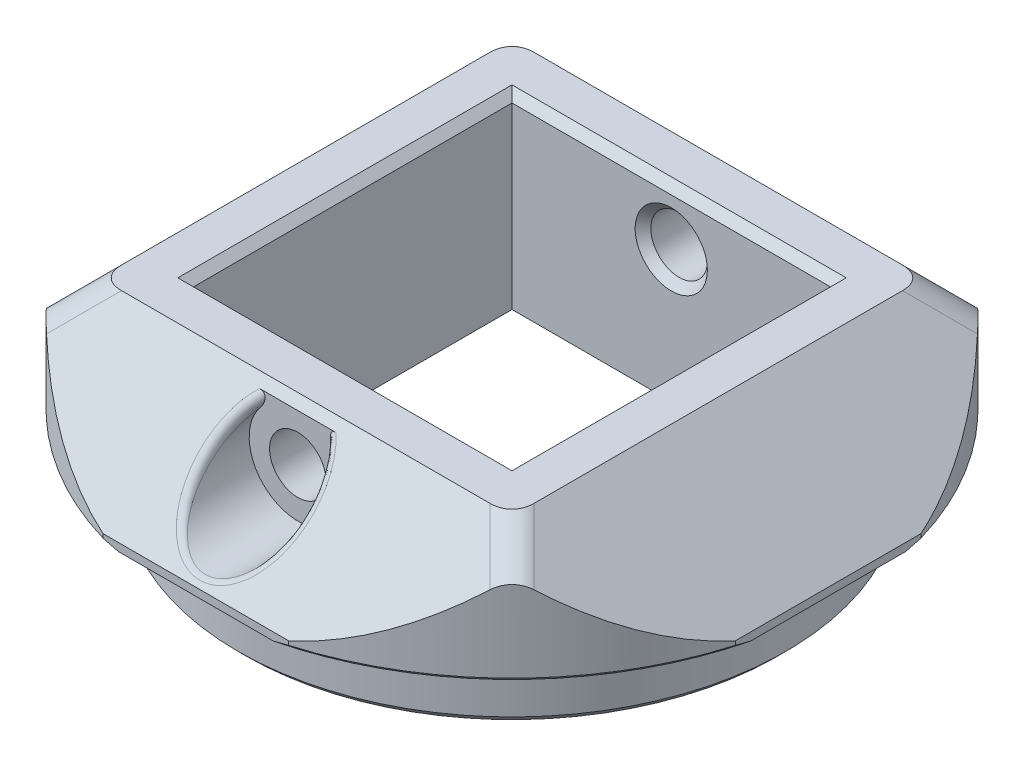
from build123d import *

# Parameters (mm, degrees)
SKETCH1_R           = 17.45
SKETCH1_W           = 20.3
SKETCH1_H           = 20.3
BOSS_EXTRUDE1_DEPTH = 4.9
SKETCH7_R           = 21
SKETCH7_W           = 20.3
SKETCH7_H           = 20.3
BOSS_EXTRUDE5_DEPTH = 0.5
SKETCH6_W           = 26.3
SKETCH6_H           = 26.3
SKETCH6_W_2         = 20.3
SKETCH6_H_2         = 20.3
BOSS_EXTRUDE4_DEPTH = 7
CHAMFER1_SIZE       = 7
CUT_EXTRUDE5_DEPTH  = 40.561123594
CUT_EXTRUDE6_START  = -3.5
SKETCH8_3_R         = 3.1
SKETCH8_3_R_2       = 1.8
CUT_EXTRUDE6_DEPTH  = 37.061123594
SKETCH9_W           = 56.090953644
SKETCH9_H           = 56.400634548
CUT_EXTRUDE7_DEPTH  = 31.512292605
SKETCH10_R          = 2.2
CUT_EXTRUDE8_DEPTH  = 7
CHAMFER2_SIZE       = 0.5
CHAMFER3_SIZE       = 0.25
FILLET1_R           = 0.5
FILLET2_R           = 2


with BuildPart() as part:
    # Sketch1 → Boss-Extrude1 (new body)
    with BuildSketch(Plane(origin=(0, 0, 0), x_dir=(1, 0, 0), z_dir=(0, 1, 0))):
        with Locations(Location((0, 0, 0), (0, 0, 270))):
            Circle(SKETCH1_R)
        Rectangle(SKETCH1_W, SKETCH1_H, mode=Mode.SUBTRACT)
    extrude(amount=BOSS_EXTRUDE1_DEPTH)

    # Sketch7 → Boss-Extrude5 (add)
    with BuildSketch(Plane(origin=(0, 4.9, 0), x_dir=(1, 0, 0), z_dir=(0, 1, 0))):
        with Locations(Location((0, 0, 0), (0, 0, 270))):
            Circle(SKETCH7_R)
        Rectangle(SKETCH7_W, SKETCH7_H, mode=Mode.SUBTRACT)
    extrude(amount=BOSS_EXTRUDE5_DEPTH)

    # Sketch6 → Boss-Extrude4 (add)
    with BuildSketch(Plane(origin=(0, 5.4, 0), x_dir=(1, 0, 0), z_dir=(0, 1, 0))):
        Rectangle(SKETCH6_W, SKETCH6_H)
        Rectangle(SKETCH6_W_2, SKETCH6_H_2, mode=Mode.SUBTRACT)
    extrude(amount=BOSS_EXTRUDE4_DEPTH)

    # Chamfer1
    # the kernel refuses this chamfer: 7 mm, written as the material it adds along each edge
    with BuildSketch(Plane(origin=(-13.15, 5.4, -13.15), x_dir=(-0.9996219169112968, -0.027495876610586358, 0), z_dir=(0, 0, 1))) as chamfer1_piece_1_section:
        Polygon((CHAMFER1_SIZE * 0.999621916911, -CHAMFER1_SIZE * 0.0274958766106), (-CHAMFER1_SIZE * 0.0274958766106, -CHAMFER1_SIZE * 0.999621916911), (0, 0), align=None)
    chamfer1_piece_1 = extrude(amount=26.3, mode=Mode.PRIVATE)
    chamfer1_piece_1 = chamfer1_piece_1 & Plane(origin=(0, 7.778644628, 0), x_dir=(0, 0, 1), z_dir=(0, -1, 0)) * Cylinder(21, 81, mode=Mode.PRIVATE)
    chamfer1_piece_1 = split(chamfer1_piece_1, bisect_by=Plane(origin=(-15.312931496, 12.4, -1e-09), z_dir=(0, -1, 0)), keep=Keep.TOP, mode=Mode.PRIVATE)
    add(chamfer1_piece_1)
    with BuildSketch(Plane(origin=(13.15, 5.4, -13.15), x_dir=(0, -0.027495876610586358, -0.9996219169112968), z_dir=(-1, 0, 0))) as chamfer1_piece_2_section:
        Polygon((CHAMFER1_SIZE * 0.999621916911, -CHAMFER1_SIZE * 0.0274958766106), (-CHAMFER1_SIZE * 0.0274958766106, -CHAMFER1_SIZE * 0.999621916911), (0, 0), align=None)
    chamfer1_piece_2 = extrude(amount=26.3, mode=Mode.PRIVATE)
    chamfer1_piece_2 = chamfer1_piece_2 & Plane(origin=(0, 7.778644628, 0), x_dir=(0, 0, 1), z_dir=(0, -1, 0)) * Cylinder(21, 81, mode=Mode.PRIVATE)
    chamfer1_piece_2 = split(chamfer1_piece_2, bisect_by=Plane(origin=(1e-09, 12.4, -15.312931496), z_dir=(0, -1, 0)), keep=Keep.TOP, mode=Mode.PRIVATE)
    add(chamfer1_piece_2)
    with BuildSketch(Plane(origin=(13.15, 5.4, 13.15), x_dir=(0.9996219169112968, -0.027495876610586358, 0), z_dir=(0, 0, -1))) as chamfer1_piece_3_section:
        Polygon((CHAMFER1_SIZE * 0.999621916911, -CHAMFER1_SIZE * 0.0274958766106), (-CHAMFER1_SIZE * 0.0274958766106, -CHAMFER1_SIZE * 0.999621916911), (0, 0), align=None)
    chamfer1_piece_3 = extrude(amount=26.3, mode=Mode.PRIVATE)
    chamfer1_piece_3 = chamfer1_piece_3 & Plane(origin=(0, 7.778644628, 0), x_dir=(0, 0, 1), z_dir=(0, -1, 0)) * Cylinder(21, 81, mode=Mode.PRIVATE)
    chamfer1_piece_3 = split(chamfer1_piece_3, bisect_by=Plane(origin=(15.312931496, 12.4, 1e-09), z_dir=(0, -1, 0)), keep=Keep.TOP, mode=Mode.PRIVATE)
    add(chamfer1_piece_3)
    with BuildSketch(Plane(origin=(-13.15, 5.4, 13.15), x_dir=(0, -0.027495876610586358, 0.9996219169112968), z_dir=(1, 0, 0))) as chamfer1_piece_4_section:
        Polygon((CHAMFER1_SIZE * 0.999621916911, -CHAMFER1_SIZE * 0.0274958766106), (-CHAMFER1_SIZE * 0.0274958766106, -CHAMFER1_SIZE * 0.999621916911), (0, 0), align=None)
    chamfer1_piece_4 = extrude(amount=26.3, mode=Mode.PRIVATE)
    chamfer1_piece_4 = chamfer1_piece_4 & Plane(origin=(0, 7.778644628, 0), x_dir=(0, 0, 1), z_dir=(0, -1, 0)) * Cylinder(21, 81, mode=Mode.PRIVATE)
    chamfer1_piece_4 = split(chamfer1_piece_4, bisect_by=Plane(origin=(5e-09, 12.4, 15.312931502), z_dir=(0, -1, 0)), keep=Keep.TOP, mode=Mode.PRIVATE)
    add(chamfer1_piece_4)
    with BuildSketch(Plane(origin=(13.15, 5.4, -13.15), x_dir=(0, -0.027495876610586358, -0.9996219169112968), z_dir=(-1, 0, 0))) as chamfer1_piece_5a_section:
        Polygon((CHAMFER1_SIZE * 0.999621916911, -CHAMFER1_SIZE * 0.0274958766106), (-CHAMFER1_SIZE * 0.0274958766106, -CHAMFER1_SIZE * 0.999621916911), (0, 0), align=None)
    chamfer1_piece_5a = extrude(amount=44.301780916, mode=Mode.PRIVATE)
    chamfer1_piece_5a = chamfer1_piece_5a & Plane(origin=(0, 8.454798528, 0), x_dir=(0, 0, 1), z_dir=(0, -1, 0)) * Cylinder(21, 117, mode=Mode.PRIVATE)
    chamfer1_piece_5a = split(chamfer1_piece_5a, bisect_by=Plane(origin=(-13.15, 8.454798528, -14.047221262), z_dir=(-1, 0, 0)), keep=Keep.TOP, mode=Mode.PRIVATE)
    chamfer1_piece_5a = split(chamfer1_piece_5a, bisect_by=Plane(origin=(-14.361884476, 12.4, -14.047221262), z_dir=(0, -1, 0)), keep=Keep.TOP, mode=Mode.PRIVATE)
    with BuildSketch(Plane(origin=(-13.15, 5.4, -31.151780916), x_dir=(-0.9996219169112968, -0.027495876610586358, 0), z_dir=(0, 0, 1))) as chamfer1_piece_5b_section:
        Polygon((CHAMFER1_SIZE * 0.999621916911, -CHAMFER1_SIZE * 0.0274958766106), (-CHAMFER1_SIZE * 0.0274958766106, -CHAMFER1_SIZE * 0.999621916911), (0, 0), align=None)
    chamfer1_piece_5b = extrude(amount=44.301780916, mode=Mode.PRIVATE)
    chamfer1_piece_5b = chamfer1_piece_5b & Plane(origin=(0, 8.454798526, 0), x_dir=(0, 0, 1), z_dir=(0, -1, 0)) * Cylinder(21, 117, mode=Mode.PRIVATE)
    chamfer1_piece_5b = split(chamfer1_piece_5b, bisect_by=Plane(origin=(-14.047221262, 8.454798526, -13.15), z_dir=(0, 0, -1)), keep=Keep.TOP, mode=Mode.PRIVATE)
    chamfer1_piece_5b = split(chamfer1_piece_5b, bisect_by=Plane(origin=(-14.047221262, 12.4, -14.361884476), z_dir=(0, -1, 0)), keep=Keep.TOP, mode=Mode.PRIVATE)
    chamfer1_piece_5 = chamfer1_piece_5a & chamfer1_piece_5b
    add(chamfer1_piece_5)
    with BuildSketch(Plane(origin=(-31.151780916, 5.4, 13.15), x_dir=(0, -0.027495876610586358, 0.9996219169112968), z_dir=(1, 0, 0))) as chamfer1_piece_6a_section:
        Polygon((CHAMFER1_SIZE * 0.999621916911, -CHAMFER1_SIZE * 0.0274958766106), (-CHAMFER1_SIZE * 0.0274958766106, -CHAMFER1_SIZE * 0.999621916911), (0, 0), align=None)
    chamfer1_piece_6a = extrude(amount=44.301780916, mode=Mode.PRIVATE)
    chamfer1_piece_6a = chamfer1_piece_6a & Plane(origin=(0, 8.454798528, 0), x_dir=(0, 0, 1), z_dir=(0, -1, 0)) * Cylinder(21, 117, mode=Mode.PRIVATE)
    chamfer1_piece_6a = split(chamfer1_piece_6a, bisect_by=Plane(origin=(-13.15, 8.454798528, 14.047221262), z_dir=(-1, 0, 0)), keep=Keep.TOP, mode=Mode.PRIVATE)
    chamfer1_piece_6a = split(chamfer1_piece_6a, bisect_by=Plane(origin=(-14.361884478, 12.4, 14.047221262), z_dir=(0, -1, 0)), keep=Keep.TOP, mode=Mode.PRIVATE)
    with BuildSketch(Plane(origin=(-13.15, 5.4, -13.15), x_dir=(-0.9996219169112968, -0.027495876610586358, 0), z_dir=(0, 0, 1))) as chamfer1_piece_6b_section:
        Polygon((CHAMFER1_SIZE * 0.999621916911, -CHAMFER1_SIZE * 0.0274958766106), (-CHAMFER1_SIZE * 0.0274958766106, -CHAMFER1_SIZE * 0.999621916911), (0, 0), align=None)
    chamfer1_piece_6b = extrude(amount=44.301780916, mode=Mode.PRIVATE)
    chamfer1_piece_6b = chamfer1_piece_6b & Plane(origin=(0, 8.454798528, 0), x_dir=(0, 0, 1), z_dir=(0, -1, 0)) * Cylinder(21, 117, mode=Mode.PRIVATE)
    chamfer1_piece_6b = split(chamfer1_piece_6b, bisect_by=Plane(origin=(-14.047221262, 8.454798528, 13.15), z_dir=(0, 0, 1)), keep=Keep.TOP, mode=Mode.PRIVATE)
    chamfer1_piece_6b = split(chamfer1_piece_6b, bisect_by=Plane(origin=(-14.047221262, 12.4, 14.361884476), z_dir=(0, -1, 0)), keep=Keep.TOP, mode=Mode.PRIVATE)
    chamfer1_piece_6 = chamfer1_piece_6a & chamfer1_piece_6b
    add(chamfer1_piece_6)
    with BuildSketch(Plane(origin=(13.15, 5.4, 13.15), x_dir=(0.9996219169112968, -0.027495876610586358, 0), z_dir=(0, 0, -1))) as chamfer1_piece_7a_section:
        Polygon((CHAMFER1_SIZE * 0.999621916911, -CHAMFER1_SIZE * 0.0274958766106), (-CHAMFER1_SIZE * 0.0274958766106, -CHAMFER1_SIZE * 0.999621916911), (0, 0), align=None)
    chamfer1_piece_7a = extrude(amount=44.301780916, mode=Mode.PRIVATE)
    chamfer1_piece_7a = chamfer1_piece_7a & Plane(origin=(0, 8.454798529, 0), x_dir=(0, 0, 1), z_dir=(0, -1, 0)) * Cylinder(21, 117, mode=Mode.PRIVATE)
    chamfer1_piece_7a = split(chamfer1_piece_7a, bisect_by=Plane(origin=(14.047221263, 12.4, -14.361884476), z_dir=(0, -1, 0)), keep=Keep.TOP, mode=Mode.PRIVATE)
    chamfer1_piece_7a = split(chamfer1_piece_7a, bisect_by=Plane(origin=(14.047221263, 8.454798529, -13.15), z_dir=(0, 0, -1)), keep=Keep.TOP, mode=Mode.PRIVATE)
    with BuildSketch(Plane(origin=(31.151780916, 5.4, -13.15), x_dir=(0, -0.027495876610586358, -0.9996219169112968), z_dir=(-1, 0, 0))) as chamfer1_piece_7b_section:
        Polygon((CHAMFER1_SIZE * 0.999621916911, -CHAMFER1_SIZE * 0.0274958766106), (-CHAMFER1_SIZE * 0.0274958766106, -CHAMFER1_SIZE * 0.999621916911), (0, 0), align=None)
    chamfer1_piece_7b = extrude(amount=44.301780916, mode=Mode.PRIVATE)
    chamfer1_piece_7b = chamfer1_piece_7b & Plane(origin=(0, 8.454798526, 0), x_dir=(0, 0, 1), z_dir=(0, -1, 0)) * Cylinder(21, 117, mode=Mode.PRIVATE)
    chamfer1_piece_7b = split(chamfer1_piece_7b, bisect_by=Plane(origin=(14.361884476, 12.4, -14.047221262), z_dir=(0, -1, 0)), keep=Keep.TOP, mode=Mode.PRIVATE)
    chamfer1_piece_7b = split(chamfer1_piece_7b, bisect_by=Plane(origin=(13.15, 8.454798526, -14.047221262), z_dir=(1, 0, 0)), keep=Keep.TOP, mode=Mode.PRIVATE)
    chamfer1_piece_7 = chamfer1_piece_7a & chamfer1_piece_7b
    add(chamfer1_piece_7)
    with BuildSketch(Plane(origin=(-13.15, 5.4, 13.15), x_dir=(0, -0.027495876610586358, 0.9996219169112968), z_dir=(1, 0, 0))) as chamfer1_piece_8a_section:
        Polygon((CHAMFER1_SIZE * 0.999621916911, -CHAMFER1_SIZE * 0.0274958766106), (-CHAMFER1_SIZE * 0.0274958766106, -CHAMFER1_SIZE * 0.999621916911), (0, 0), align=None)
    chamfer1_piece_8a = extrude(amount=44.301780916, mode=Mode.PRIVATE)
    chamfer1_piece_8a = chamfer1_piece_8a & Plane(origin=(0, 8.454798527, 0), x_dir=(0, 0, 1), z_dir=(0, -1, 0)) * Cylinder(21, 117, mode=Mode.PRIVATE)
    chamfer1_piece_8a = split(chamfer1_piece_8a, bisect_by=Plane(origin=(14.361884477, 12.4, 14.047221262), z_dir=(0, -1, 0)), keep=Keep.TOP, mode=Mode.PRIVATE)
    chamfer1_piece_8a = split(chamfer1_piece_8a, bisect_by=Plane(origin=(13.15, 8.454798527, 14.047221262), z_dir=(1, 0, 0)), keep=Keep.TOP, mode=Mode.PRIVATE)
    with BuildSketch(Plane(origin=(13.15, 5.4, 31.151780916), x_dir=(0.9996219169112968, -0.027495876610586358, 0), z_dir=(0, 0, -1))) as chamfer1_piece_8b_section:
        Polygon((CHAMFER1_SIZE * 0.999621916911, -CHAMFER1_SIZE * 0.0274958766106), (-CHAMFER1_SIZE * 0.0274958766106, -CHAMFER1_SIZE * 0.999621916911), (0, 0), align=None)
    chamfer1_piece_8b = extrude(amount=44.301780916, mode=Mode.PRIVATE)
    chamfer1_piece_8b = chamfer1_piece_8b & Plane(origin=(0, 8.454798526, 0), x_dir=(0, 0, 1), z_dir=(0, -1, 0)) * Cylinder(21, 117, mode=Mode.PRIVATE)
    chamfer1_piece_8b = split(chamfer1_piece_8b, bisect_by=Plane(origin=(14.047221262, 12.4, 14.361884476), z_dir=(0, -1, 0)), keep=Keep.TOP, mode=Mode.PRIVATE)
    chamfer1_piece_8b = split(chamfer1_piece_8b, bisect_by=Plane(origin=(14.047221262, 8.454798526, 13.15), z_dir=(0, 0, 1)), keep=Keep.TOP, mode=Mode.PRIVATE)
    chamfer1_piece_8 = chamfer1_piece_8a & chamfer1_piece_8b
    add(chamfer1_piece_8)

    # Sketch8 → Cut-Extrude5 (cut, through all)
    with BuildSketch(Plane.XY.offset(-10.15)):
        with BuildLine():
            ThreePointArc((1.8, 8.9), (1.272792206, 10.172792206), (0, 10.7))
            Line((0, 10.7), (0, 7.1))
            ThreePointArc((0, 7.1), (1.272792206, 7.627207794), (1.8, 8.9))
        make_face()
        with BuildLine():
            Line((0, 7.1), (0, 10.7))
            ThreePointArc((0, 10.7), (-1.8, 8.9), (0, 7.1))
        make_face()
    cut_extrude5 = extrude(amount=-CUT_EXTRUDE5_DEPTH, mode=Mode.SUBTRACT)

    # Sketch8<3> → Cut-Extrude6 (cut, through all)
    with BuildSketch(Plane.XY.offset(-10.15).offset(CUT_EXTRUDE6_START)):
        with Locations((0, 8.9)):
            Circle(SKETCH8_3_R)
        with Locations((0, 8.9)):
            Circle(SKETCH8_3_R_2, mode=Mode.SUBTRACT)
    cut_extrude6 = extrude(amount=-CUT_EXTRUDE6_DEPTH, mode=Mode.SUBTRACT)

    # Mirror1: Cut-Extrude5, Cut-Extrude6 across plane
    add(cut_extrude5.mirror(Plane.XY), mode=Mode.SUBTRACT)
    add(cut_extrude6.mirror(Plane.XY), mode=Mode.SUBTRACT)

    # Sketch9 → Cut-Extrude7 (cut, through all)
    with BuildSketch(Plane(origin=(0, 5.4, 0), x_dir=(1, 0, 0), z_dir=(0, 1, 0))):
        with Locations((1.296788783, -1.393564066)):
            Rectangle(SKETCH9_W, SKETCH9_H)
        Polygon((-5.91417788, 20.15), (5.91417788, 20.15), (20.15, 20.15), (20.15, 5.91417788), (20.15, -5.91417788), (20.15, -20.15), (5.91417788, -20.15), (-5.91417788, -20.15), (-20.15, -20.15), (-20.15, -5.91417788), (-20.15, 5.91417788), (-20.15, 20.15), align=None, mode=Mode.SUBTRACT)
    extrude(amount=-CUT_EXTRUDE7_DEPTH, mode=Mode.SUBTRACT)

    # Sketch10 → Cut-Extrude8 (cut)
    with BuildSketch(Plane.XZ):
        with Locations(Location((13.8, 0, 0), (0, 0, 270))):
            Circle(SKETCH10_R)
        with Locations(Location((-13.8, 0, 0), (0, 0, 90))):
            Circle(SKETCH10_R)
    extrude(amount=-CUT_EXTRUDE8_DEPTH, mode=Mode.SUBTRACT)

    # Chamfer2
    chamfer2_edges = [part.edges().sort_by_distance(p)[0] for p in [
        (-13.8, 0, -2.2),
        (13.8, 0, 2.2),
        (0, 0, -17.45),
        (-10.15, 12.4, 0),
        (0, 12.4, 10.15),
        (10.15, 12.4, 0),
        (0, 12.4, -10.15),
        (10.15, 0, 0),
        (0, 10.7, -10.15),
        (0, 0, -10.15),
        (-10.15, 0, 0),
        (0, 0, 10.15),
        (0, 10.7, 10.15),
    ]]
    chamfer(chamfer2_edges, length=CHAMFER2_SIZE)

    # Chamfer3
    chamfer3_edges = [part.edges().sort_by_distance(p)[0] for p in [
        (14.849242405, 4.9, -14.849242405),
        (-14.849242405, 4.9, -14.849242405),
        (-14.849242405, 4.9, 14.849242405),
        (14.849242405, 4.9, 14.849242405),
    ]]
    chamfer(chamfer3_edges, length=CHAMFER3_SIZE)

    # Fillet1
    fillet1_edges = [part.edges().sort_by_distance(p)[0] for p in [
        (-2.14545063, 6.662358028, 18.887641972),
        (-2.145531679, 6.662435741, -18.887564259),
    ]]
    fillet(fillet1_edges, radius=FILLET1_R)

    # Fillet2
    fillet2_edges = [part.edges().sort_by_distance(p)[0] for p in [
        (-13.999621202, 11.550378798, -13.999621202),
        (-13.999621202, 11.550378798, 13.999621202),
        (13.999621202, 11.550378798, 13.999621202),
        (13.999621202, 11.550378798, -13.999621202),
    ]]
    fillet(fillet2_edges, radius=FILLET2_R)


solid = part.part
